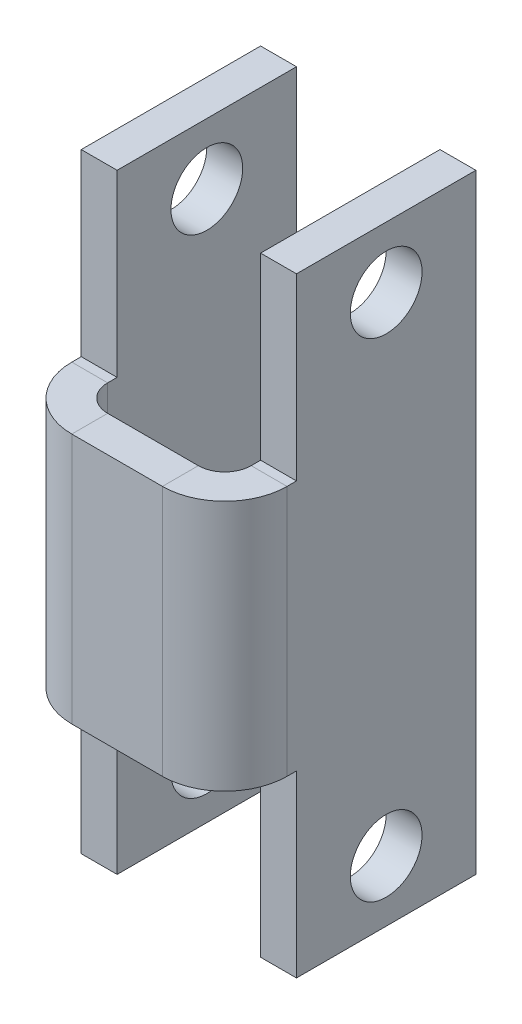
from build123d import *

# Parameters (mm, degrees)
CROQUIS1_W                         = 6
CROQUIS1_H                         = 17
BRIDA_BASE1_DEPTH                  = 1
BRIDA_DE_ARISTA1_STRIP_W           = 5.4732
BRIDA_DE_ARISTA1_STRIP_H           = 1
BRIDA_DE_ARISTA1_STRIP_CUT_DEPTH   = 17
BRIDA_DE_ARISTA1_STRIP_2_W         = 5.4732
BRIDA_DE_ARISTA1_STRIP_2_H         = 1
BRIDA_DE_ARISTA1_STRIP_CUT_2_DEPTH = 17
BRIDA_DE_ARISTA1_DEPTH             = 17
BRIDA_DE_ARISTA1_BEND_DEPTH        = 17
CROQUIS12_W                        = 2
CROQUIS12_H                        = 5
CORTAR_EXTRUIR1_DEPTH              = 10
CROQUIS13_R                        = 1
CORTAR_EXTRUIR2_DEPTH              = 10


# Sheet-metal steps are written as plain solids
with BuildPart() as part:
    # Croquis1 → Brida base1 (new body)
    with BuildSketch(Plane.XY):
        with Locations((3, 8.5)):
            Rectangle(CROQUIS1_W, CROQUIS1_H)
    extrude(amount=-BRIDA_BASE1_DEPTH)

    # Brida de arista1 strip (across the edge) → Brida de arista1 strip cut (cut)
    with BuildSketch(Plane(origin=(6, 17, -1), x_dir=(-1, 0, 0), z_dir=(0, -1, 0))):
        with Locations((-1, -0.5)):
            Rectangle(BRIDA_DE_ARISTA1_STRIP_W, BRIDA_DE_ARISTA1_STRIP_H)
    extrude(amount=BRIDA_DE_ARISTA1_STRIP_CUT_DEPTH, mode=Mode.SUBTRACT)

    # Brida de arista1 strip 2 (across the edge) → Brida de arista1 strip cut 2 (cut)
    with BuildSketch(Plane(origin=(0, 0, -1), x_dir=(1, 0, 0), z_dir=(0, 1, 0))):
        with Locations((-1, -0.5)):
            Rectangle(BRIDA_DE_ARISTA1_STRIP_2_W, BRIDA_DE_ARISTA1_STRIP_2_H)
    extrude(amount=BRIDA_DE_ARISTA1_STRIP_CUT_2_DEPTH, mode=Mode.SUBTRACT)

    # Brida de arista1 section (across the edge) → Brida de arista1 (add)
    with BuildSketch(Plane(origin=(6, 17, -1), x_dir=(-1, 0, 0), z_dir=(0, -1, 0))):
        with BuildLine():
            Line((0, 0.7366), (0, 6))
            Line((0, 6), (1, 6))
            Line((1, 6), (1, 0.7366))
            ThreePointArc((1, 0.7366), (1.215745145, 0.215745145), (1.7366, 0))
            Line((1.7366, 0), (1.7366, -1))
            ThreePointArc((1.7366, -1), (0.508638364, -0.491361636), (0, 0.7366))
        make_face()
    extrude(amount=BRIDA_DE_ARISTA1_DEPTH)

    # Brida de arista1 section 2 (across the edge) → Brida de arista1 bend (add)
    with BuildSketch(Plane(origin=(0, 0, -1), x_dir=(1, 0, 0), z_dir=(0, 1, 0))):
        with BuildLine():
            Line((0, 0.7366), (0, 6))
            Line((0, 6), (1, 6))
            Line((1, 6), (1, 0.7366))
            ThreePointArc((1, 0.7366), (1.215745145, 0.215745145), (1.7366, 0))
            Line((1.7366, 0), (1.7366, -1))
            ThreePointArc((1.7366, -1), (0.508638364, -0.491361636), (0, 0.7366))
        make_face()
    extrude(amount=BRIDA_DE_ARISTA1_BEND_DEPTH)

    # Croquis12 → Cortar-Extruir1 (cut)
    with BuildSketch(Plane(origin=(6, 0, 0), x_dir=(0, 0, -1), z_dir=(1, 0, 0))):
        with Locations((1, 14.5)):
            Rectangle(CROQUIS12_W, CROQUIS12_H)
        with Locations((1, 2.5)):
            Rectangle(CROQUIS12_W, CROQUIS12_H)
    extrude(amount=-CORTAR_EXTRUIR1_DEPTH, mode=Mode.SUBTRACT)

    # Croquis13 → Cortar-Extruir2 (cut)
    with BuildSketch(Plane(origin=(6, 0, 0), x_dir=(0, 0, -1), z_dir=(1, 0, 0))):
        with Locations((4.5, 15.3)):
            Circle(CROQUIS13_R)
        with Locations((4.5, 1.7)):
            Circle(CROQUIS13_R)
    extrude(amount=-CORTAR_EXTRUIR2_DEPTH, mode=Mode.SUBTRACT)


solid = part.part
